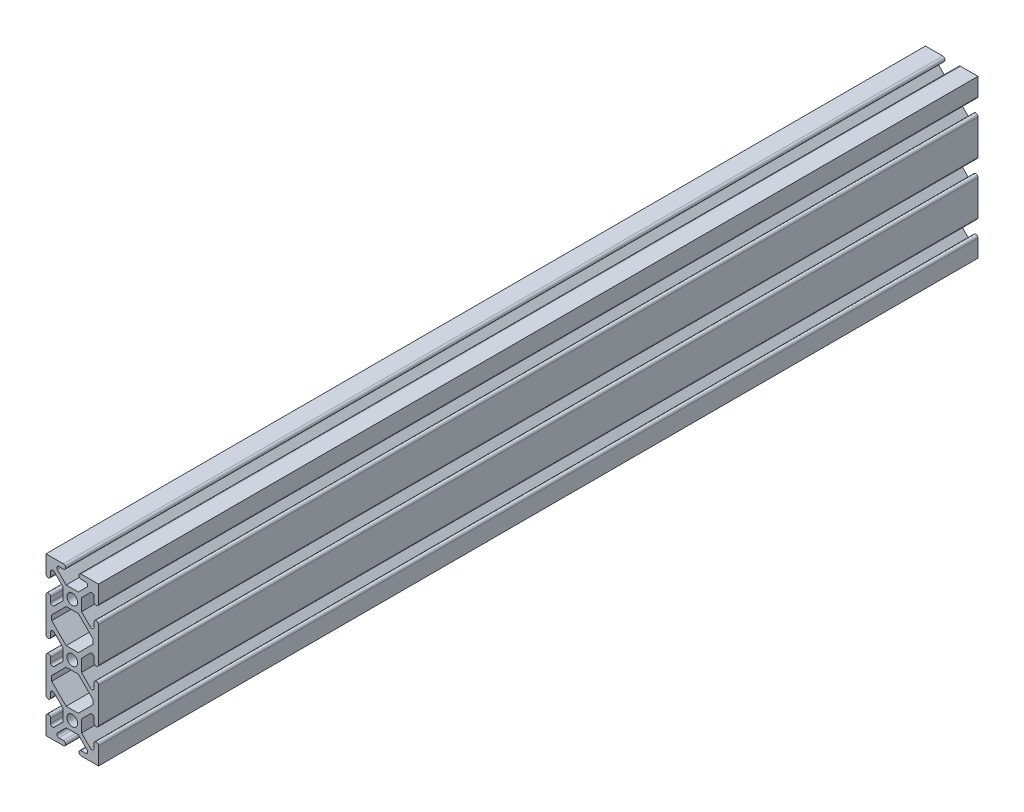
from build123d import *

# Parameters (mm, degrees)
SKETCH1_R           = 2.6035
BOSS_EXTRUDE1_DEPTH = 425.45


with BuildPart() as part:
    # Sketch1 → Boss-Extrude1 (new body)
    with BuildSketch(Plane.XY):
        with BuildLine():
            Line((-8.75577951, -7.193214945), (-4.5085, -2.945935435))
            Line((-4.5085, -2.945935435), (-4.5085, 2.945935435))
            Line((-4.5085, 2.945935435), (-8.75577951, 7.193214945))
            ThreePointArc((-8.75577951, 7.193214945), (-9.863006367, 7.413456061), (-10.4902, 6.474794456))
            Line((-10.4902, 6.474794456), (-10.4902, 4.302307889))
            ThreePointArc((-10.4902, 4.302307889), (-11.5951, 3.197407889), (-12.7, 4.302307889))
            Line((-12.7, 4.302307889), (-12.7, 21.097692111))
            ThreePointArc((-12.7, 21.097692111), (-11.5951, 22.202592111), (-10.4902, 21.097692111))
            Line((-10.4902, 21.097692111), (-10.4902, 18.925205544))
            ThreePointArc((-10.4902, 18.925205544), (-9.863006367, 17.986543939), (-8.75577951, 18.206785055))
            Line((-8.75577951, 18.206785055), (-4.5085, 22.454064565))
            Line((-4.5085, 22.454064565), (-4.5085, 28.345935435))
            Line((-4.5085, 28.345935435), (-8.75577951, 32.593214945))
            ThreePointArc((-8.75577951, 32.593214945), (-9.863006367, 32.813456061), (-10.4902, 31.874794456))
            Line((-10.4902, 31.874794456), (-10.4902, 29.702307889))
            ThreePointArc((-10.4902, 29.702307889), (-11.5951, 28.597407889), (-12.7, 29.702307889))
            Line((-12.7, 29.702307889), (-12.7, 38.1))
            Line((-12.7, 38.1), (-4.302307889, 38.1))
            ThreePointArc((-4.302307889, 38.1), (-3.197407889, 36.9951), (-4.302307889, 35.8902))
            Line((-4.302307889, 35.8902), (-6.474794456, 35.8902))
            ThreePointArc((-6.474794456, 35.8902), (-7.413456061, 35.263006367), (-7.193214945, 34.15577951))
            Line((-7.193214945, 34.15577951), (-2.945935435, 29.9085))
            Line((-2.945935435, 29.9085), (2.945935435, 29.9085))
            Line((2.945935435, 29.9085), (7.193214945, 34.15577951))
            ThreePointArc((7.193214945, 34.15577951), (7.413456061, 35.263006367), (6.474794456, 35.8902))
            Line((6.474794456, 35.8902), (4.302307889, 35.8902))
            ThreePointArc((4.302307889, 35.8902), (3.197407889, 36.9951), (4.302307889, 38.1))
            Line((4.302307889, 38.1), (12.7, 38.1))
            Line((12.7, 38.1), (12.7, 29.702307889))
            ThreePointArc((12.7, 29.702307889), (11.5951, 28.597407889), (10.4902, 29.702307889))
            Line((10.4902, 29.702307889), (10.4902, 31.874794456))
            ThreePointArc((10.4902, 31.874794456), (9.863006367, 32.813456061), (8.75577951, 32.593214945))
            Line((8.75577951, 32.593214945), (4.5085, 28.345935435))
            Line((4.5085, 28.345935435), (4.5085, 22.454064565))
            Line((4.5085, 22.454064565), (8.75577951, 18.206785055))
            ThreePointArc((8.75577951, 18.206785055), (9.863006367, 17.986543939), (10.4902, 18.925205544))
            Line((10.4902, 18.925205544), (10.4902, 21.097692082))
            ThreePointArc((10.4902, 21.097692082), (11.5951, 22.202592082), (12.7, 21.097692082))
            Line((12.7, 21.097692082), (12.7, 4.302307889))
            ThreePointArc((12.7, 4.302307889), (11.5951, 3.197407889), (10.4902, 4.302307889))
            Line((10.4902, 4.302307889), (10.4902, 6.474794456))
            ThreePointArc((10.4902, 6.474794456), (9.863006367, 7.413456061), (8.75577951, 7.193214945))
            Line((8.75577951, 7.193214945), (4.5085, 2.945935435))
            Line((4.5085, 2.945935435), (4.5085, -2.945935435))
            Line((4.5085, -2.945935435), (8.680690989, -7.266998826))
            ThreePointArc((8.680690989, -7.266998826), (9.897349311, -7.583329931), (10.4902, -6.474794456))
            Line((10.4902, -6.474794456), (10.4902, -4.302307889))
            ThreePointArc((10.4902, -4.302307889), (11.5951, -3.197407889), (12.7, -4.302307889))
            Line((12.7, -4.302307889), (12.7, -21.097692058))
            ThreePointArc((12.7, -21.097692058), (11.5951, -22.202592058), (10.4902, -21.097692058))
            Line((10.4902, -21.097692058), (10.4902, -18.925205544))
            ThreePointArc((10.4902, -18.925205544), (9.863006367, -17.986543939), (8.75577951, -18.206785055))
            Line((8.75577951, -18.206785055), (4.5085, -22.454064565))
            Line((4.5085, -22.454064565), (4.5085, -28.345935435))
            Line((4.5085, -28.345935435), (8.75577951, -32.593214945))
            ThreePointArc((8.75577951, -32.593214945), (9.863006367, -32.813456061), (10.4902, -31.874794456))
            Line((10.4902, -31.874794456), (10.4902, -29.702307918))
            ThreePointArc((10.4902, -29.702307918), (11.5951, -28.597407918), (12.7, -29.702307918))
            Line((12.7, -29.702307918), (12.7, -38.1))
            Line((12.7, -38.1), (4.302307889, -38.1))
            ThreePointArc((4.302307889, -38.1), (3.197407889, -36.9951), (4.302307889, -35.8902))
            Line((4.302307889, -35.8902), (6.474794456, -35.8902))
            ThreePointArc((6.474794456, -35.8902), (7.413456061, -35.263006367), (7.193214945, -34.15577951))
            Line((7.193214945, -34.15577951), (2.945935435, -29.9085))
            Line((2.945935435, -29.9085), (-2.945935435, -29.9085))
            Line((-2.945935435, -29.9085), (-7.193214945, -34.15577951))
            ThreePointArc((-7.193214945, -34.15577951), (-7.413456061, -35.263006367), (-6.474794456, -35.8902))
            Line((-6.474794456, -35.8902), (-4.302307889, -35.8902))
            ThreePointArc((-4.302307889, -35.8902), (-3.197407889, -36.9951), (-4.302307889, -38.1))
            Line((-4.302307889, -38.1), (-12.7, -38.1))
            Line((-12.7, -38.1), (-12.7, -29.702307889))
            ThreePointArc((-12.7, -29.702307889), (-11.5951, -28.597407889), (-10.4902, -29.702307889))
            Line((-10.4902, -29.702307889), (-10.4902, -31.874794456))
            ThreePointArc((-10.4902, -31.874794456), (-9.863006367, -32.813456061), (-8.75577951, -32.593214945))
            Line((-8.75577951, -32.593214945), (-4.5085, -28.345935435))
            Line((-4.5085, -28.345935435), (-4.5085, -22.454064565))
            Line((-4.5085, -22.454064565), (-8.75577951, -18.206785055))
            ThreePointArc((-8.75577951, -18.206785055), (-9.863006367, -17.986543939), (-10.4902, -18.925205544))
            Line((-10.4902, -18.925205544), (-10.4902, -21.097692111))
            ThreePointArc((-10.4902, -21.097692111), (-11.5951, -22.202592111), (-12.7, -21.097692111))
            Line((-12.7, -21.097692111), (-12.7, -4.302307889))
            ThreePointArc((-12.7, -4.302307889), (-11.5951, -3.197407889), (-10.4902, -4.302307889))
            Line((-10.4902, -4.302307889), (-10.4902, -6.474794456))
            ThreePointArc((-10.4902, -6.474794456), (-9.863006367, -7.413456061), (-8.75577951, -7.193214945))
        make_face()
        with Locations((0, 25.4)):
            Circle(SKETCH1_R, mode=Mode.SUBTRACT)
        with Locations((0, -25.4)):
            Circle(SKETCH1_R, mode=Mode.SUBTRACT)
        Circle(SKETCH1_R, mode=Mode.SUBTRACT)
        Polygon((-9.9314, 13.906035435), (-9.9314, 11.493964565), (-2.945935435, 4.5085), (2.945935435, 4.5085), (9.9314, 11.493964565), (9.9314, 13.906035435), (2.945935435, 20.8915), (-2.945935435, 20.8915), align=None, mode=Mode.SUBTRACT)
        Polygon((-9.9314, -11.493964565), (-9.9314, -13.906035435), (-2.945935435, -20.8915), (2.945935435, -20.8915), (9.9314, -13.906035435), (9.9314, -11.493964565), (2.945935435, -4.5085), (-2.945935435, -4.5085), align=None, mode=Mode.SUBTRACT)
    extrude(amount=-BOSS_EXTRUDE1_DEPTH)


solid = part.part
